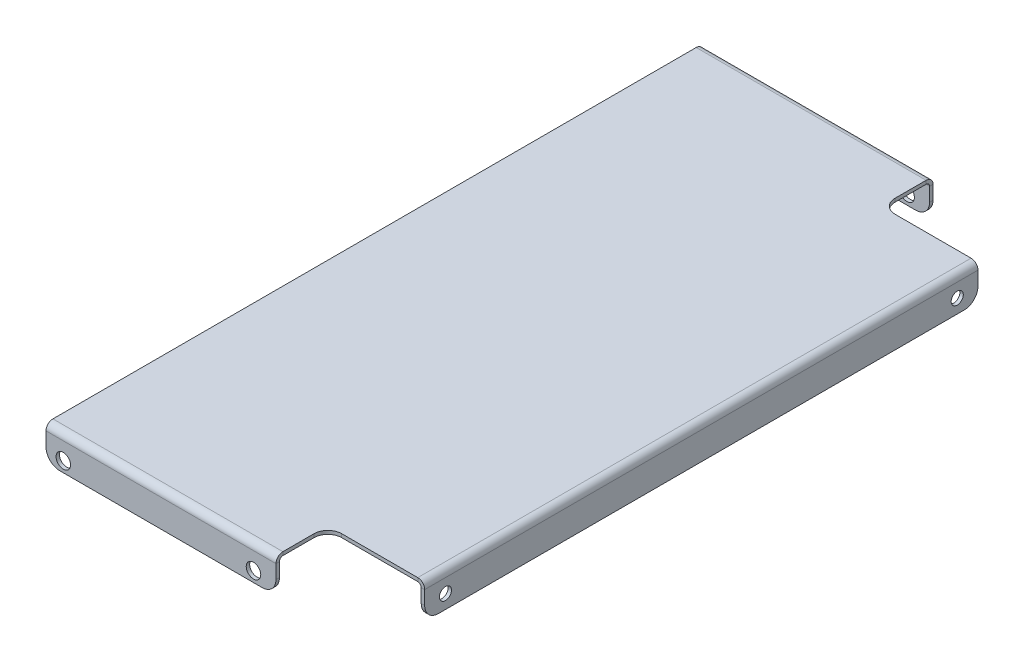
from build123d import *

# Parameters (mm, degrees)
SM_BASE_FLANGE_1_DEPTH             = 1
SM_EDGE_FLANGE_1_STRIP_W           = 6
SM_EDGE_FLANGE_1_STRIP_H           = 1
SM_EDGE_FLANGE_1_STRIP_CUT_DEPTH   = 160
SM_EDGE_FLANGE_1_DEPTH             = 160
SM_EDGE_FLANGE_2_STRIP_W           = 6
SM_EDGE_FLANGE_2_STRIP_H           = 1
SM_EDGE_FLANGE_2_STRIP_CUT_DEPTH   = 66.5
SM_EDGE_FLANGE_2_STRIP_2_W         = 6
SM_EDGE_FLANGE_2_STRIP_2_H         = 1
SM_EDGE_FLANGE_2_STRIP_CUT_2_DEPTH = 66.5
SM_EDGE_FLANGE_2_DEPTH             = 66.5
SM_EDGE_FLANGE_2_BEND_DEPTH        = 66.5
SKETCH_15_R                        = 1.75
CUT_EXTRUDE_1_DEPTH                = 10
FILLET_1_R                         = 4
SKETCH_16_R                        = 2.1
CUT_EXTRUDE_2_DEPTH                = 213.438814721


# Sheet-metal steps are written as plain solids
with BuildPart() as part:
    # Sketch 1 → Базовая кромка1 (new body)
    with BuildSketch(Plane(origin=(0, 0, 0), x_dir=(1, 0, 0), z_dir=(0, 1, 0))):
        Polygon((0, 0), (66.5, 0), (66.5, -14), (94.5, -14), (94.5, -174), (66.5, -174), (66.5, -188), (0, -188), align=None)
    extrude(amount=-SM_BASE_FLANGE_1_DEPTH)

    # Ребро-кромка1 strip (across the edge) → Ребро-кромка1 strip cut (cut)
    with BuildSketch(Plane(origin=(94.5, -1, 14), x_dir=(-1, 0, 0), z_dir=(0, 0, 1))):
        with Locations((-1, -0.5)):
            Rectangle(SM_EDGE_FLANGE_1_STRIP_W, SM_EDGE_FLANGE_1_STRIP_H)
    extrude(amount=SM_EDGE_FLANGE_1_STRIP_CUT_DEPTH, mode=Mode.SUBTRACT)

    # Ребро-кромка1 section (across the edge) → Ребро-кромка1 (add)
    with BuildSketch(Plane(origin=(94.5, -1, 14), x_dir=(-1, 0, 0), z_dir=(0, 0, 1))):
        with BuildLine():
            Line((0, 1), (0, 9))
            Line((0, 9), (1, 9))
            Line((1, 9), (1, 1))
            ThreePointArc((1, 1), (1.292893219, 0.292893219), (2, 0))
            Line((2, 0), (2, -1))
            ThreePointArc((2, -1), (0.585786438, -0.414213562), (0, 1))
        make_face()
    extrude(amount=SM_EDGE_FLANGE_1_DEPTH)

    # Ребро-кромка2 strip (across the edge) → Ребро-кромка2 strip cut (cut)
    with BuildSketch(Plane(origin=(66.5, -1, 188), x_dir=(0, 0, -1), z_dir=(-1, 0, 0))):
        with Locations((-2, -0.5)):
            Rectangle(SM_EDGE_FLANGE_2_STRIP_W, SM_EDGE_FLANGE_2_STRIP_H)
    extrude(amount=SM_EDGE_FLANGE_2_STRIP_CUT_DEPTH, mode=Mode.SUBTRACT)

    # Ребро-кромка2 strip 2 (across the edge) → Ребро-кромка2 strip cut 2 (cut)
    with BuildSketch(Plane(origin=(0, -1, 0), x_dir=(0, 0, 1), z_dir=(1, 0, 0))):
        with Locations((-2, -0.5)):
            Rectangle(SM_EDGE_FLANGE_2_STRIP_2_W, SM_EDGE_FLANGE_2_STRIP_2_H)
    extrude(amount=SM_EDGE_FLANGE_2_STRIP_CUT_2_DEPTH, mode=Mode.SUBTRACT)

    # Ребро-кромка2 section (across the edge) → Ребро-кромка2 (add)
    with BuildSketch(Plane(origin=(66.5, -1, 188), x_dir=(0, 0, -1), z_dir=(-1, 0, 0))):
        with BuildLine():
            Line((-1, 1), (-1, 9))
            Line((-1, 9), (0, 9))
            Line((0, 9), (0, 1))
            ThreePointArc((0, 1), (0.292893219, 0.292893219), (1, 0))
            Line((1, 0), (1, -1))
            ThreePointArc((1, -1), (-0.414213562, -0.414213562), (-1, 1))
        make_face()
    extrude(amount=SM_EDGE_FLANGE_2_DEPTH)

    # Ребро-кромка2 section 2 (across the edge) → Ребро-кромка2 bend (add)
    with BuildSketch(Plane(origin=(0, -1, 0), x_dir=(0, 0, 1), z_dir=(1, 0, 0))):
        with BuildLine():
            Line((-1, 1), (-1, 9))
            Line((-1, 9), (0, 9))
            Line((0, 9), (0, 1))
            ThreePointArc((0, 1), (0.292893219, 0.292893219), (1, 0))
            Line((1, 0), (1, -1))
            ThreePointArc((1, -1), (-0.414213562, -0.414213562), (-1, 1))
        make_face()
    extrude(amount=SM_EDGE_FLANGE_2_BEND_DEPTH)

    # Эскиз15 → Вырез-Вытянуть1 (cut)
    with BuildSketch(Plane(origin=(94.5, 0, 0), x_dir=(0, 0, -1), z_dir=(1, 0, 0))):
        with Locations(Location((-168, -6, 0), (0, 0, 90))):
            Circle(SKETCH_15_R)
        with Locations(Location((-20, -6, 0), (0, 0, 90))):
            Circle(SKETCH_15_R)
    extrude(amount=-CUT_EXTRUDE_1_DEPTH, mode=Mode.SUBTRACT)

    # Скругление1
    fillet_1_edges = [part.edges().sort_by_distance(p)[0] for p in [
        (0, -10, -0.5),
        (66.5, -10, -0.5),
        (66.5, -0.5, 14),
        (66.5, -0.5, 174),
        (94, -10, 14),
        (94, -10, 174),
        (66.5, -10, 188.5),
        (0, -10, 188.5),
    ]]
    fillet(fillet_1_edges, radius=FILLET_1_R)

    # Эскиз16 → Вырез-Вытянуть2 (cut, through all)
    with BuildSketch(Plane.XY.offset(189)):
        with Locations((5, -7)):
            Circle(SKETCH_16_R)
        with Locations((60, -7)):
            Circle(SKETCH_16_R)
    extrude(amount=-CUT_EXTRUDE_2_DEPTH, mode=Mode.SUBTRACT)


solid = part.part
